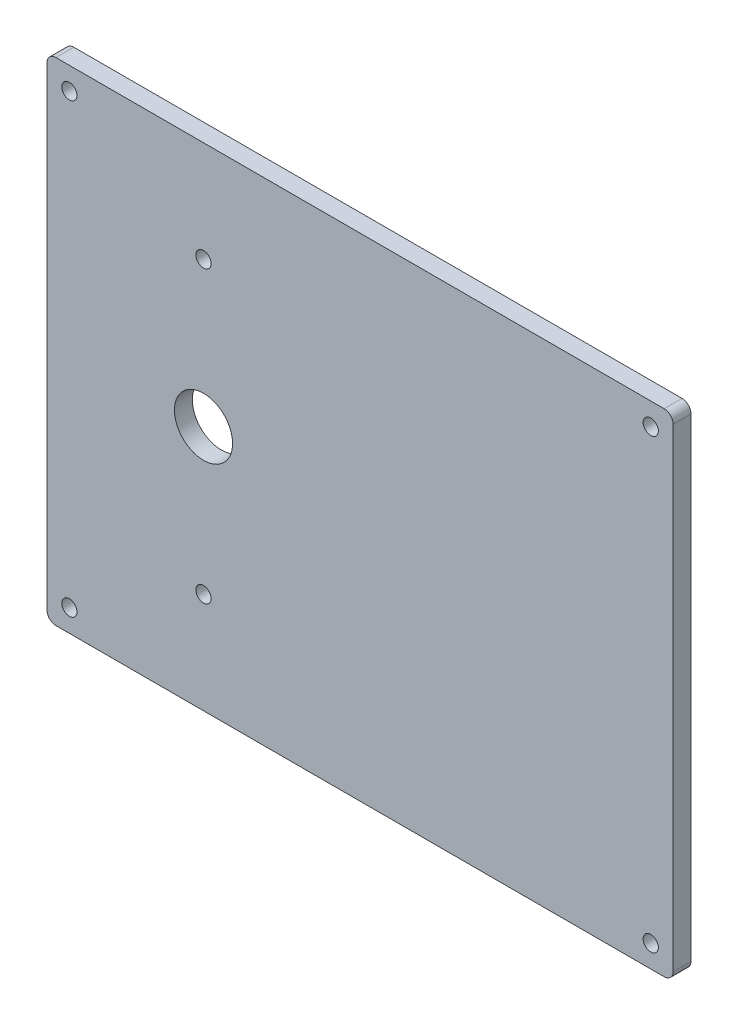
from build123d import *

# Parameters (mm, degrees)
SKETCH1_W           = 140
SKETCH1_H           = 110
BOSS_EXTRUDE1_DEPTH = 4
SKETCH2_R           = 1.7
SKETCH2_R_2         = 6.5
CUT_EXTRUDE1_DEPTH  = 4
FILLET1_R           = 2


with BuildPart() as part:
    # Sketch1 → Boss-Extrude1 (new body)
    with BuildSketch(Plane.XY):
        with Locations((68.890553518, 13.538855224)):
            Rectangle(SKETCH1_W, SKETCH1_H)
    extrude(amount=BOSS_EXTRUDE1_DEPTH)

    # Sketch2 → Cut-Extrude1 (cut)
    with BuildSketch(Plane(origin=(0, 0, 0), x_dir=(-1, 0, 0), z_dir=(0, 0, -1))):
        with Locations((-133.890553518, 63.538855224)):
            Circle(SKETCH2_R)
        with Locations((-3.890553518, 63.538855224)):
            Circle(SKETCH2_R)
        with Locations((-133.890553518, -36.461144776)):
            Circle(SKETCH2_R)
        with Locations((-3.890553518, -36.461144776)):
            Circle(SKETCH2_R)
        with Locations((-33.890553518, 13.538855224)):
            Circle(SKETCH2_R_2)
        with Locations((-33.890553518, -18.891144776)):
            Circle(SKETCH2_R)
        with Locations((-33.890553518, 45.968855224)):
            Circle(SKETCH2_R)
    extrude(amount=-CUT_EXTRUDE1_DEPTH, mode=Mode.SUBTRACT)

    # Fillet1
    fillet1_edges = [part.edges().sort_by_distance(p)[0] for p in [
        (138.890553518, -41.461144776, 2),
        (-1.109446482, -41.461144776, 2),
        (-1.109446482, 68.538855224, 2),
        (138.890553518, 68.538855224, 2),
    ]]
    fillet(fillet1_edges, radius=FILLET1_R)


solid = part.part
